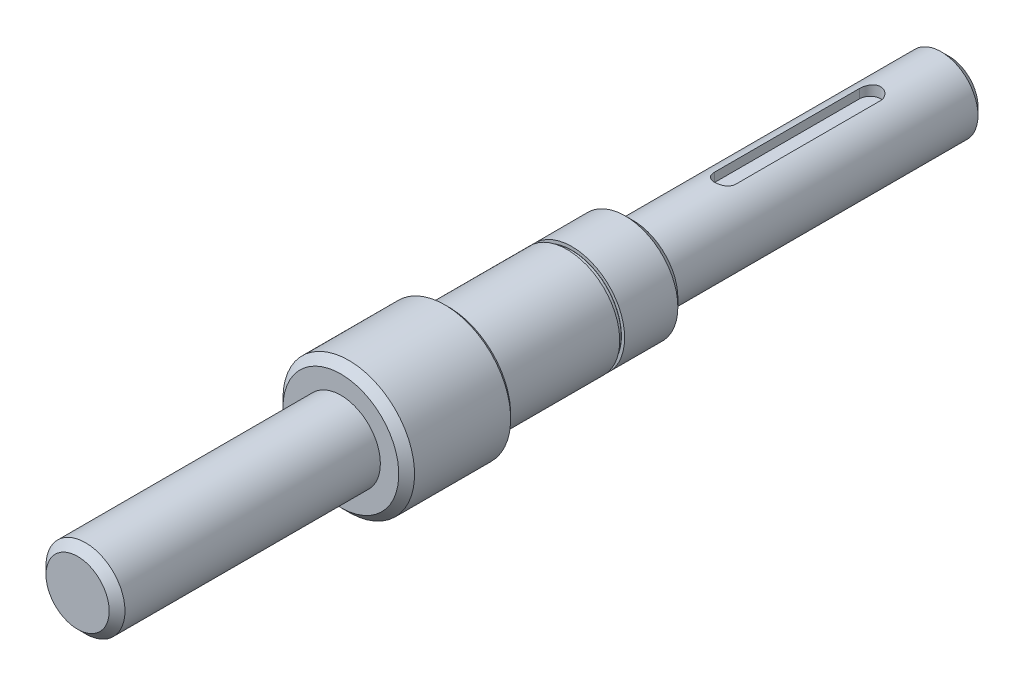
from build123d import *

# Parameters (mm, degrees)
CHAMFER_1_SIZE         = 3
HOLE_WIZARD_M121_D     = 10.2
HOLE_WIZARD_M121_DEPTH = 30
HOLE_WIZARD_M121_TIP   = 3.064389157
SKETCH_4_R             = 20
SKETCH_4_R_2           = 18.75
CUT_EXTRUDE_1_DEPTH    = 1.85
FILLET_1_R             = 0.05
CHAMFER_2_SIZE         = 1.5
CUT_EXTRUDE_2_DEPTH    = 334.782863551
SKETCH_9_R             = 25
SKETCH_9_R_2           = 20
CUT_EXTRUDE_4_DEPTH    = 6
CHAMFER_3_SIZE         = 1.5
CHAMFER_4_SIZE         = 3


# Read off the part's stored shape, not the designer's step: Условная геометрия резьбовых отверстий
with BuildPart() as part:
    # Эскиз1 → Повернуть1 (revolve)
    with BuildSketch(Plane(origin=(0, 0, 0), x_dir=(0, 0, -1), z_dir=(1, 0, 0)), mode=Mode.PRIVATE) as revolve_1_sk:
        Polygon((0, 0), (0, 15), (100, 15), (100, 25), (147, 25), (147, 20), (211, 20), (211, 14), (331, 14), (331, 0), align=None)
    revolve(revolve_1_sk.sketch.rotate(Axis((0, 0, 0), (0, 0, -1)), 90), axis=Axis((0, 0, 0), (0, 0, -1)))

    # Фаска1
    chamfer_1_edges = [part.edges().sort_by_distance(p)[0] for p in [
        (-25, 0, -100),
        (-15, 0, 0),
        (-14, 0, -331),
    ]]
    chamfer(chamfer_1_edges, length=CHAMFER_1_SIZE)

    # Отверстие обработанное метчиком M121
    with Locations(Plane(origin=(0, 0, -331), x_dir=(-1, 0, 0), z_dir=(0, 0, -1))):
        with Locations((0, 0)):
            Hole(HOLE_WIZARD_M121_D / 2, depth=HOLE_WIZARD_M121_DEPTH)
            with Locations((0, 0, -(HOLE_WIZARD_M121_DEPTH + HOLE_WIZARD_M121_TIP / 2))):  # 118° drill point
                Cone(0, HOLE_WIZARD_M121_D / 2, HOLE_WIZARD_M121_TIP, mode=Mode.SUBTRACT)

    # Эскиз4 → Вырез-Вытянуть1 (cut)
    with BuildSketch(Plane(origin=(0, 0, -187.775), x_dir=(-1, 0, 0), z_dir=(0, 0, -1))):
        with Locations(Location((0, 0, 0), (0, 0, 180))):
            Circle(SKETCH_4_R)
        Circle(SKETCH_4_R_2, mode=Mode.SUBTRACT)
    extrude(amount=-CUT_EXTRUDE_1_DEPTH, mode=Mode.SUBTRACT)

    # Скругление1
    fillet_1_edges = [part.edges().sort_by_distance(p)[0] for p in [
        (18.75, 0, -185.925),
        (18.75, 0, -187.775),
    ]]
    fillet(fillet_1_edges, radius=FILLET_1_R)

    # Фаска2
    chamfer_2_edges = [part.edges().sort_by_distance(p)[0] for p in [
        (-25, 0, -147),
    ]]
    chamfer(chamfer_2_edges, length=CHAMFER_2_SIZE)

    # Эскиз8 → Вырез-Вытянуть2 (cut, through all)
    with BuildSketch(Plane(origin=(0, 10, -331), x_dir=(-1, 0, 0), z_dir=(0, -1, 0))):
        with BuildLine():
            Line((4, -30), (4, -85))
            ThreePointArc((4, -85), (0, -89), (-4, -85))
            Line((-4, -85), (-4, -30))
            ThreePointArc((-4, -30), (0, -26), (4, -30))
        make_face()
    extrude(amount=-CUT_EXTRUDE_2_DEPTH, mode=Mode.SUBTRACT)

    # Эскиз9 → Вырез-Вытянуть4 (cut)
    with BuildSketch(Plane(origin=(0, 0, -147), x_dir=(-1, 0, 0), z_dir=(0, 0, -1))):
        Circle(SKETCH_9_R)
        Circle(SKETCH_9_R_2, mode=Mode.SUBTRACT)
    extrude(amount=-CUT_EXTRUDE_4_DEPTH, mode=Mode.SUBTRACT)

    # Фаска3
    chamfer_3_edges = [part.edges().sort_by_distance(p)[0] for p in [
        (-25, 0, -141),
    ]]
    chamfer(chamfer_3_edges, length=CHAMFER_3_SIZE)

    # Фаска4
    chamfer_4_edges = [part.edges().sort_by_distance(p)[0] for p in [
        (-20, 0, -211),
    ]]
    chamfer(chamfer_4_edges, length=CHAMFER_4_SIZE)

    # Move Face 2213 outline → Move Face 2213 (revolve, cut)
    with BuildSketch(Plane.XZ):
        Polygon((6.025, -301.555796073), (5.1, -301), (5.1, -331), (6.025, -331), align=None)
    revolve(axis=Axis((0, 0, 0), (0, 0, 1)), mode=Mode.SUBTRACT)


solid = part.part
